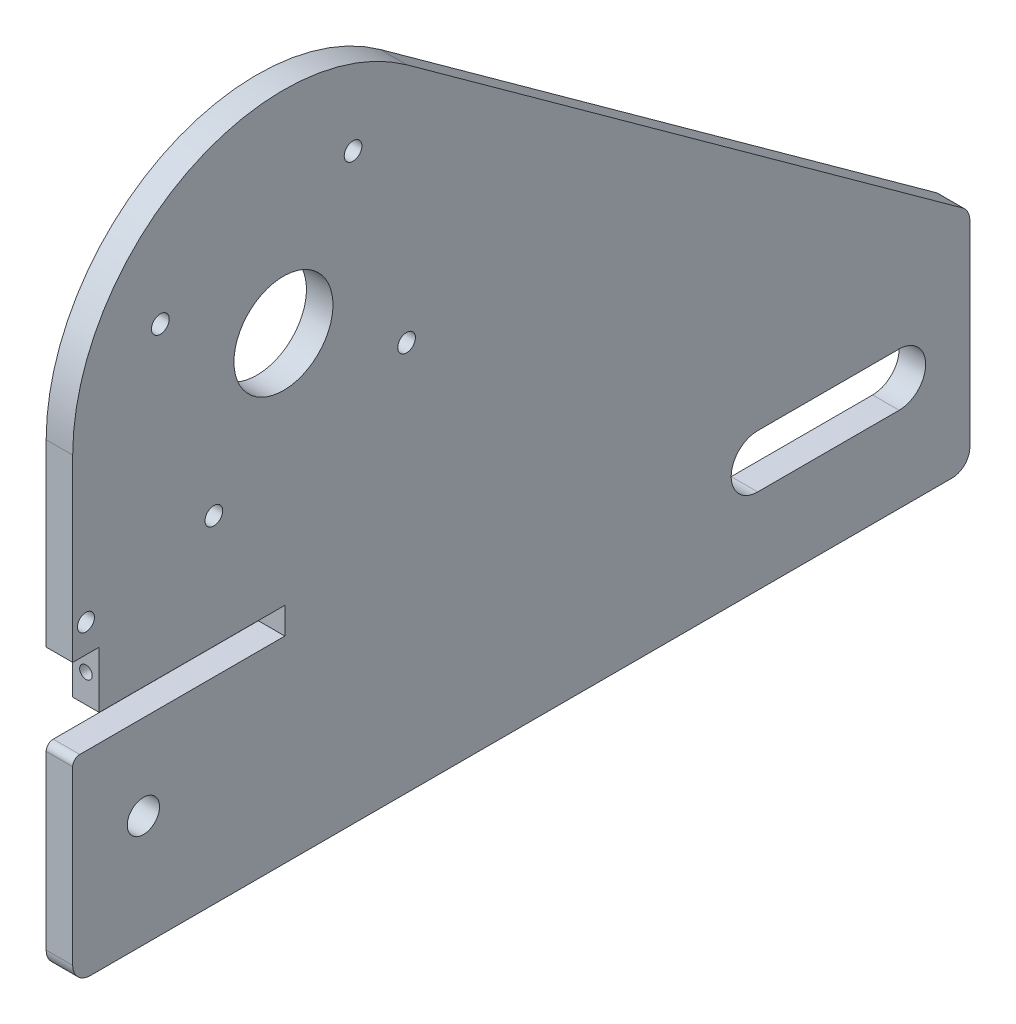
from build123d import *

# Parameters (mm, degrees)
SKETCH1_R           = 1.5875
SKETCH1_R_2         = 2.8956
SKETCH1_R_3         = 1.524
SKETCH1_R_4         = 8.89
BOSS_EXTRUDE1_DEPTH = 4.7625
SKETCH2_R           = 1.1303
CUT_EXTRUDE1_DEPTH  = 6.35


with BuildPart() as part:
    # Sketch1 → Boss-Extrude1 (new body)
    with BuildSketch(Plane(origin=(0, 0, 0), x_dir=(0, 0, -1), z_dir=(1, 0, 0))):
        with BuildLine():
            Line((-77.382795117, 0), (77.382795117, 0))
            ThreePointArc((77.382795117, 0), (79.627859148, 0.92993597), (80.557795117, 3.175))
            Line((80.557795117, 3.175), (80.557795117, 38.509654789))
            ThreePointArc((80.557795117, 38.509654789), (80.210081315, 39.954326985), (79.243100468, 41.082569284))
            Line((79.243100468, 41.082569284), (-20.530611645, 113.222382255))
            ThreePointArc((-20.530611645, 113.222382255), (-59.930107761, 116.254813413), (-80.557795117, 82.55))
            Line((-80.557795117, 82.55), (-80.557795117, 50.292))
            Line((-80.557795117, 50.292), (-75.795295117, 50.292))
            Line((-75.795295117, 50.292), (-75.795295117, 40.132))
            Line((-75.795295117, 40.132), (-42.457795117, 40.132))
            Line((-42.457795117, 40.132), (-42.457795117, 35.3441))
            Line((-42.457795117, 35.3441), (-79.287795117, 35.3441))
            ThreePointArc((-79.287795117, 35.3441), (-80.18582073, 34.972125612), (-80.557795117, 34.0741))
            Line((-80.557795117, 34.0741), (-80.557795117, 3.175))
            ThreePointArc((-80.557795117, 3.175), (-79.627859148, 0.92993597), (-77.382795117, 0))
        make_face()
        with Locations((-55.209041359, 60.43939525)):
            Circle(SKETCH1_R, mode=Mode.SUBTRACT)
        with Locations((-67.857795117, 20.066)):
            Circle(SKETCH1_R_2, mode=Mode.SUBTRACT)
        with Locations((-20.597190367, 70.048753759)):
            Circle(SKETCH1_R, mode=Mode.SUBTRACT)
        with Locations((-64.818399868, 95.051246241)):
            Circle(SKETCH1_R, mode=Mode.SUBTRACT)
        with Locations((-30.206548876, 104.66060475)):
            Circle(SKETCH1_R, mode=Mode.SUBTRACT)
        with Locations((-78.176545117, 55.372)):
            Circle(SKETCH1_R_3, mode=Mode.SUBTRACT)
        with Locations((-42.707795117, 82.55)):
            Circle(SKETCH1_R_4, mode=Mode.SUBTRACT)
        with BuildLine():
            Line((67.857795117, 15.3035), (42.457795117, 15.3035))
            ThreePointArc((42.457795117, 15.3035), (37.695295117, 20.066), (42.457795117, 24.8285))
            Line((42.457795117, 24.8285), (67.857795117, 24.8285))
            ThreePointArc((67.857795117, 24.8285), (72.620295117, 20.066), (67.857795117, 15.3035))
        make_face(mode=Mode.SUBTRACT)
    extrude(amount=BOSS_EXTRUDE1_DEPTH)

    # Sketch2 → Cut-Extrude1 (cut)
    with BuildSketch(Plane.XY.offset(75.795295117)):
        with Locations((2.38125, 45.212)):
            Circle(SKETCH2_R)
    extrude(amount=-CUT_EXTRUDE1_DEPTH, mode=Mode.SUBTRACT)


solid = part.part
